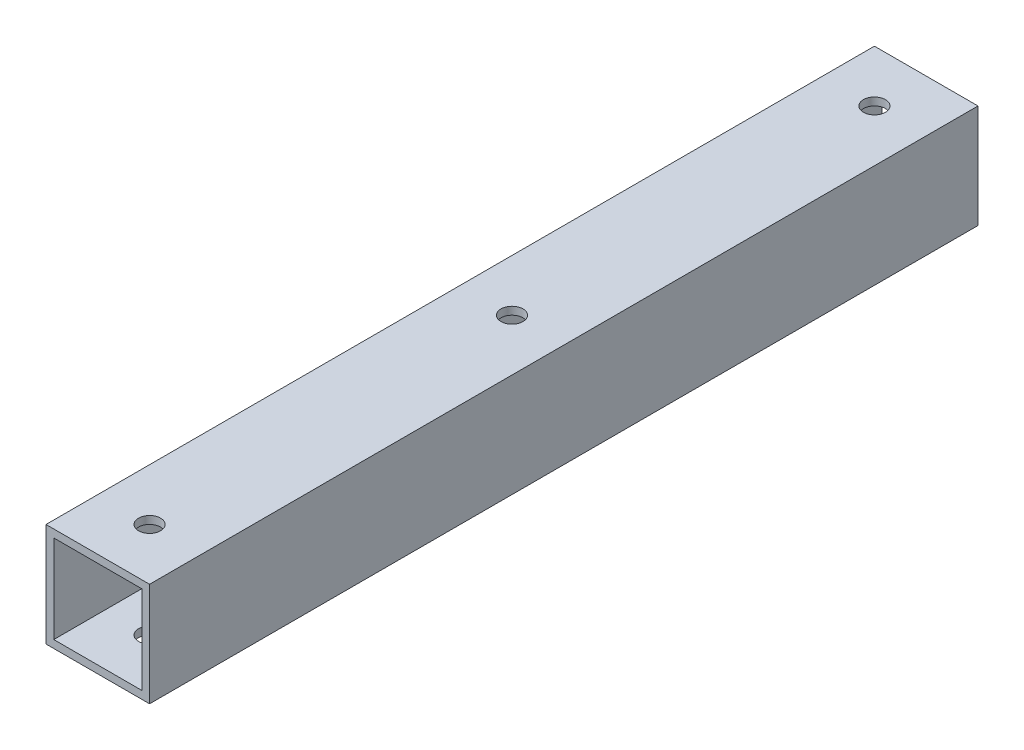
from build123d import *

# Parameters (mm, degrees)
SKETCH1_W           = 20
SKETCH1_H           = 20
SKETCH1_W_2         = 17
SKETCH1_H_2         = 17
BOSS_EXTRUDE1_DEPTH = 160
SKETCH2_R           = 2.125
CUT_EXTRUDE1_DEPTH  = 162.554944214


with BuildPart() as part:
    # Sketch1 → Boss-Extrude1 (new body)
    with BuildSketch(Plane.XY):
        Rectangle(SKETCH1_W, SKETCH1_H)
        Rectangle(SKETCH1_W_2, SKETCH1_H_2, mode=Mode.SUBTRACT)
    extrude(amount=-BOSS_EXTRUDE1_DEPTH)

    # Sketch2 → Cut-Extrude1 (cut, through all)
    with BuildSketch(Plane(origin=(0, 10, 0), x_dir=(1, 0, 0), z_dir=(0, 1, 0))):
        with Locations((0, 10)):
            Circle(SKETCH2_R)
        with Locations((0, 80)):
            Circle(SKETCH2_R)
        with Locations((0, 150)):
            Circle(SKETCH2_R)
    extrude(amount=-CUT_EXTRUDE1_DEPTH, mode=Mode.SUBTRACT)


solid = part.part
